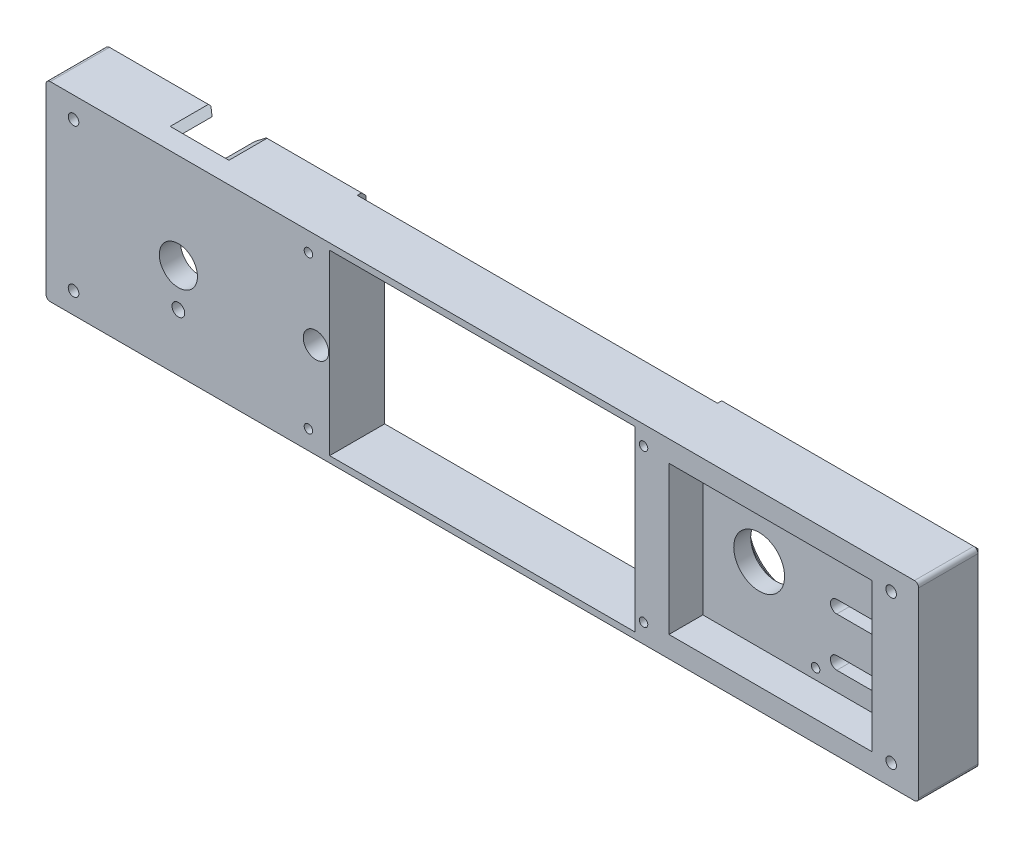
from build123d import *

# Parameters (mm, degrees)
SKETCH_1_W               = 206
SKETCH_1_H               = 45
EXTRUDE_1_DEPTH          = 15
SKETCH_1_4_W             = 85
SKETCH_1_4_H             = 45
CUT_EXTRUDE_1_DEPTH      = 2
SKETCH_1_5_W             = 72.1
SKETCH_1_5_H             = 42
CUT_EXTRUDE_2_DEPTH      = 71
SKETCH_1_6_R             = 3
CUT_EXTRUDE_3_DEPTH      = 42
SKETCH_2_R               = 22
SKETCH_2_R_2             = 4.5
CUT_EXTRUDE_4_DEPTH      = 10
SKETCH_2_3_R             = 4.5
CUT_EXTRUDE_5_DEPTH      = 50
CUT_EXTRUDE_6_DEPTH      = 17
CUT_EXTRUDE_6_DEPTH_BACK = 44
SKETCH_4_R               = 1.5
CUT_EXTRUDE_7_DEPTH      = 14
CHAMFER_1_SIZE           = 1
CHAMFER_2_SIZE           = 2
CUT_EXTRUDE_START        = -10
CUT_EXTRUDE_9_DEPTH      = 11
SKETCH_7_R               = 6
CUT_EXTRUDE_10_DEPTH     = 182
SKETCH_7_4_R             = 8.5
CUT_EXTRUDE_11_DEPTH     = 3
CHAMFER_3_SIZE           = 1
SKETCH_9_R               = 1.25
CUT_EXTRUDE_12_DEPTH     = 182
SKETCH_9_3_R             = 2.5
CUT_EXTRUDE_13_DEPTH     = 3
FILLET_1_R               = 1
SKETCH_10_W              = 47.95
SKETCH_10_H              = 35
CUT_EXTRUDE_14_DEPTH     = 8
SKETCH_11_R              = 1
CUT_EXTRUDE_15_DEPTH     = 3
CHAMFER_4_SIZE           = 1
SKETCH_12_R              = 1
CUT_EXTRUDE_16_DEPTH     = 5


with BuildPart() as part:
    # 草图1 → 凸台-拉伸1 (new body)
    with BuildSketch(Plane.XY):
        with Locations((103, 22.5)):
            Rectangle(SKETCH_1_W, SKETCH_1_H)
    extrude(amount=EXTRUDE_1_DEPTH)

    # 草图1<4> → 切除-拉伸1 (cut)
    with BuildSketch(Plane.XY):
        with Locations((103, 22.5)):
            Rectangle(SKETCH_1_4_W, SKETCH_1_4_H)
    extrude(amount=CUT_EXTRUDE_1_DEPTH, mode=Mode.SUBTRACT)

    # 草图1<5> → 切除-拉伸2 (cut)
    with BuildSketch(Plane.XY):
        with Locations((103, 22.5)):
            Rectangle(SKETCH_1_5_W, SKETCH_1_5_H)
    extrude(amount=CUT_EXTRUDE_2_DEPTH, mode=Mode.SUBTRACT)

    # 草图1<6> → 切除-拉伸3 (cut)
    with BuildSketch(Plane.XY):
        with Locations(Location((63.725, 22.5, 0), (0, 0, 180))):
            Circle(SKETCH_1_6_R)
    extrude(amount=CUT_EXTRUDE_3_DEPTH, mode=Mode.SUBTRACT)

    # 草图2 → 切除-拉伸4 (cut)
    with BuildSketch(Plane(origin=(0, 0, 0), x_dir=(-1, 0, 0), z_dir=(0, 0, -1))):
        with Locations((-31.25, 22.5)):
            Circle(SKETCH_2_R)
        with Locations((-31.25, 22.5)):
            Circle(SKETCH_2_R_2, mode=Mode.SUBTRACT)
    extrude(amount=-CUT_EXTRUDE_4_DEPTH, mode=Mode.SUBTRACT)

    # 草图2<3> → 切除-拉伸5 (cut)
    with BuildSketch(Plane(origin=(0, 0, 0), x_dir=(-1, 0, 0), z_dir=(0, 0, -1))):
        with Locations((-31.25, 22.5)):
            Circle(SKETCH_2_3_R)
    extrude(amount=-CUT_EXTRUDE_5_DEPTH, mode=Mode.SUBTRACT)

    # 草图4 → 切除-拉伸6 (cut, two sides: drawn at the far end of the back side and taken through both)
    with BuildSketch(Plane.XY.offset(15).offset(-CUT_EXTRUDE_6_DEPTH_BACK)):
        with Locations(Location((31.25, 13.5, 0), (0, 0, 180))):
            Circle(SKETCH_4_R)
    extrude(amount=CUT_EXTRUDE_6_DEPTH + CUT_EXTRUDE_6_DEPTH_BACK, mode=Mode.SUBTRACT)

    # 草图5 → 切除-拉伸7 (cut)
    with BuildSketch(Plane(origin=(0, 0, 0), x_dir=(-1, 0, 0), z_dir=(0, 0, -1))):
        with BuildLine():
            Line((-186.665399759, 35.5), (-178.665399759, 35.5))
            ThreePointArc((-178.665399759, 35.5), (-177.165399759, 34), (-178.665399759, 32.5))
            Line((-178.665399759, 32.5), (-186.665399759, 32.5))
            ThreePointArc((-186.665399759, 32.5), (-188.165399759, 34), (-186.665399759, 35.5))
        make_face()
        with BuildLine():
            Line((-186.665399759, 12.5), (-178.665399759, 12.5))
            ThreePointArc((-178.665399759, 12.5), (-177.165399759, 11), (-178.665399759, 9.5))
            Line((-178.665399759, 9.5), (-186.665399759, 9.5))
            ThreePointArc((-186.665399759, 9.5), (-188.165399759, 11), (-186.665399759, 12.5))
        make_face()
        with BuildLine():
            Line((-186.665399759, 24), (-178.665399759, 24))
            ThreePointArc((-178.665399759, 24), (-177.165399759, 22.5), (-178.665399759, 21))
            Line((-178.665399759, 21), (-186.665399759, 21))
            ThreePointArc((-186.665399759, 21), (-188.165399759, 22.5), (-186.665399759, 24))
        make_face()
    extrude(amount=-CUT_EXTRUDE_7_DEPTH, mode=Mode.SUBTRACT)

    # 倒角1
    chamfer_1_edges = [part.edges().sort_by_distance(p)[0] for p in [
        (182.665399759, 21, 0),
        (177.165399759, 22.5, 0),
        (182.665399759, 24, 0),
        (188.165399759, 34, 0),
        (182.665399759, 32.5, 0),
        (177.165399759, 34, 0),
        (182.665399759, 35.5, 0),
        (188.165399759, 11, 0),
        (182.665399759, 9.5, 0),
        (177.165399759, 11, 0),
        (182.665399759, 12.5, 0),
        (188.165399759, 22.5, 0),
    ]]
    chamfer(chamfer_1_edges, length=CHAMFER_1_SIZE)

    # 倒角2
    # the kernel refuses this chamfer: 2 mm, written as the material it takes off along each edge
    with BuildSketch(Plane(origin=(31.25, 22.5, 0), x_dir=(-1, 0, 0), z_dir=(0, -1, 0))) as chamfer_2_piece_1:
        Polygon((22 + CHAMFER_2_SIZE, 0), (22, -CHAMFER_2_SIZE), (22, 0), align=None)
    revolve(axis=Axis((31.25, 22.5, 0), (0, 0, -1)), mode=Mode.SUBTRACT)

    # 切除-拉伸9: read off the stored shape, not the designer's step
    # 切除-拉伸9 outline → 切除-拉伸9 (cut)
    with BuildSketch(Plane(origin=(0, 0, 0), x_dir=(-1, 0, 0), z_dir=(0, 0, -1)).offset(CUT_EXTRUDE_START)):
        with BuildLine():
            ThreePointArc((-25.017060641, 1.401410783), (-31.25, 0.5), (-37.482939359, 1.401410783))
            Line((-37.482939359, 1.401410783), (-39.910254038, 0))
            Line((-39.910254038, 0), (-22.898353456, 0))
            ThreePointArc((-22.898353456, 0), (-22.804826441, 0.034937268), (-22.711445573, 0.070263303))
            Line((-22.711445573, 0.070263303), (-25.017060641, 1.401410783))
        make_face()
        with BuildLine():
            Line((-38.17820323, 45), (-36.296231546, 43.913443142))
            ThreePointArc((-36.296231546, 43.913443142), (-31.25, 44.5), (-26.203768454, 43.913443142))
            Line((-26.203768454, 43.913443142), (-24.32179677, 45))
            Line((-24.32179677, 45), (-38.17820323, 45))
        make_face()
    extrude(amount=CUT_EXTRUDE_9_DEPTH, mode=Mode.SUBTRACT)

    # 草图7 → 切除-拉伸10 (cut)
    with BuildSketch(Plane(origin=(0, 0, 0), x_dir=(-1, 0, 0), z_dir=(0, 0, -1))):
        with Locations((-160.341805483, 22.5)):
            Circle(SKETCH_7_R)
    extrude(amount=-CUT_EXTRUDE_10_DEPTH, mode=Mode.SUBTRACT)

    # 草图7<4> → 切除-拉伸11 (cut)
    with BuildSketch(Plane(origin=(0, 0, 0), x_dir=(-1, 0, 0), z_dir=(0, 0, -1))):
        with Locations((-160.341805483, 22.5)):
            Circle(SKETCH_7_4_R)
    extrude(amount=-CUT_EXTRUDE_11_DEPTH, mode=Mode.SUBTRACT)

    # 倒角3
    chamfer_3_edges = [part.edges().sort_by_distance(p)[0] for p in [
        (168.841805483, 22.5, 0),
    ]]
    chamfer(chamfer_3_edges, length=CHAMFER_3_SIZE)

    # 草图9 → 切除-拉伸12 (cut)
    with BuildSketch(Plane(origin=(0, 0, 0), x_dir=(-1, 0, 0), z_dir=(0, 0, -1))):
        with Locations((-199.5, 40)):
            Circle(SKETCH_9_R)
        with Locations((-199.5, 5)):
            Circle(SKETCH_9_R)
        with Locations((-6.5, 5)):
            Circle(SKETCH_9_R)
        with Locations((-6.5, 40)):
            Circle(SKETCH_9_R)
    extrude(amount=-CUT_EXTRUDE_12_DEPTH, mode=Mode.SUBTRACT)

    # 草图9<3> → 切除-拉伸13 (cut)
    with BuildSketch(Plane(origin=(0, 0, 0), x_dir=(-1, 0, 0), z_dir=(0, 0, -1))):
        with Locations((-199.5, 40)):
            Circle(SKETCH_9_3_R)
        with Locations((-199.5, 5)):
            Circle(SKETCH_9_3_R)
        with Locations((-6.5, 5)):
            Circle(SKETCH_9_3_R)
        with Locations((-6.5, 40)):
            Circle(SKETCH_9_3_R)
    extrude(amount=-CUT_EXTRUDE_13_DEPTH, mode=Mode.SUBTRACT)

    # 圆角1
    fillet_1_edges = [part.edges().sort_by_distance(p)[0] for p in [
        (0, 0, 7.5),
        (206, 0, 7.5),
        (206, 45, 7.5),
        (0, 45, 7.5),
    ]]
    fillet(fillet_1_edges, radius=FILLET_1_R)

    # 草图10 → 切除-拉伸14 (cut)
    with BuildSketch(Plane.XY.offset(15)):
        with Locations((171.025, 22.5)):
            Rectangle(SKETCH_10_W, SKETCH_10_H)
    extrude(amount=-CUT_EXTRUDE_14_DEPTH, mode=Mode.SUBTRACT)

    # 草图11 → 切除-拉伸15 (cut)
    with BuildSketch(Plane.XY.offset(7)):
        with Locations((191.665399759, 37.5)):
            Circle(SKETCH_11_R)
        with Locations((173.665399759, 37.5)):
            Circle(SKETCH_11_R)
        with Locations((173.665399759, 7.5)):
            Circle(SKETCH_11_R)
        with Locations((191.665399759, 7.5)):
            Circle(SKETCH_11_R)
    extrude(amount=-CUT_EXTRUDE_15_DEPTH, mode=Mode.SUBTRACT)

    # 倒角4
    # the kernel refuses this chamfer: 1 mm, written as the material it takes off along each edge
    with BuildSketch(Plane(origin=(142.928317012, 0, 0), x_dir=(0, 1, 0), z_dir=(1, 0, 0)), Plane(origin=(205, 45, 0), x_dir=(0, -1, 0), z_dir=(-1, 0, 0))) as chamfer_4_piece_1:
        Polygon((CHAMFER_4_SIZE, 0), (0, CHAMFER_4_SIZE), (0, 0), align=None)
    extrude(amount=62.071682988, mode=Mode.SUBTRACT)
    with BuildSketch(Plane(origin=(205, 1, 0), x_dir=(0, -1, 0), z_dir=(-1, 0, 0))) as chamfer_4_piece_2:
        Polygon((1 - CHAMFER_4_SIZE, 0), (1, CHAMFER_4_SIZE), (1, 0), align=None)
    revolve(axis=Axis((205, 1, 0), (0, 0, 1)), revolution_arc=90, mode=Mode.SUBTRACT)
    with BuildSketch(Plane(origin=(206, 1, 0), x_dir=(-1, 0, 0), z_dir=(0, 1, 0)), Plane(origin=(0, 44, 0), x_dir=(1, 0, 0), z_dir=(0, -1, 0))) as chamfer_4_piece_3:
        Polygon((CHAMFER_4_SIZE, 0), (0, CHAMFER_4_SIZE), (0, 0), align=None)
    extrude(amount=43, mode=Mode.SUBTRACT)
    with BuildSketch(Plane(origin=(205, 44, 0), x_dir=(0, 1, 0), z_dir=(-1, 0, 0))) as chamfer_4_piece_4:
        Polygon((1 - CHAMFER_4_SIZE, 0), (1, -CHAMFER_4_SIZE), (1, 0), align=None)
    revolve(axis=Axis((205, 44, 0), (0, 0, -1)), revolution_arc=90, mode=Mode.SUBTRACT)
    with BuildSketch(Plane(origin=(37.33857105, 0, 0), x_dir=(0, 0, 1), z_dir=(1, 0, 0))) as chamfer_4_piece_5:
        Polygon((CHAMFER_4_SIZE, 0), (0, -CHAMFER_4_SIZE), (0, 0), align=None)
    extrude(amount=25.733111938, mode=Mode.SUBTRACT)
    with BuildSketch(Plane(origin=(63.071682988, 45, 0), x_dir=(0, 0, 1), z_dir=(-1, 0, 0))) as chamfer_4_piece_6:
        Polygon((CHAMFER_4_SIZE, 0), (0, -CHAMFER_4_SIZE), (0, 0), align=None)
    extrude(amount=27.841897523, mode=Mode.SUBTRACT)
    with BuildSketch(Plane(origin=(1, 0, 0), x_dir=(0, 0, 1), z_dir=(1, 0, 0))) as chamfer_4_piece_7:
        Polygon((CHAMFER_4_SIZE, 0), (0, -CHAMFER_4_SIZE), (0, 0), align=None)
    extrude(amount=24.470036444, mode=Mode.SUBTRACT)
    with BuildSketch(Plane(origin=(27.270214535, 45, 0), x_dir=(0, 0, 1), z_dir=(-1, 0, 0))) as chamfer_4_piece_8:
        Polygon((CHAMFER_4_SIZE, 0), (0, -CHAMFER_4_SIZE), (0, 0), align=None)
    extrude(amount=26.270214535, mode=Mode.SUBTRACT)
    with BuildSketch(Plane(origin=(1, 1, 0), x_dir=(0, -1, 0), z_dir=(1, 0, 0))) as chamfer_4_piece_9:
        Polygon((1 - CHAMFER_4_SIZE, 0), (1, -CHAMFER_4_SIZE), (1, 0), align=None)
    revolve(axis=Axis((1, 1, 0), (0, 0, -1)), revolution_arc=90, mode=Mode.SUBTRACT)
    with BuildSketch(Plane(origin=(1, 44, 0), x_dir=(0, 1, 0), z_dir=(1, 0, 0))) as chamfer_4_piece_10:
        Polygon((1 - CHAMFER_4_SIZE, 0), (1, CHAMFER_4_SIZE), (1, 0), align=None)
    revolve(axis=Axis((1, 44, 0), (0, 0, 1)), revolution_arc=90, mode=Mode.SUBTRACT)

    # 草图12 → 切除-拉伸16 (cut)
    with BuildSketch(Plane.XY.offset(15)):
        with Locations((61.95, 40.5)):
            Circle(SKETCH_12_R)
        with Locations((61.95, 4.5)):
            Circle(SKETCH_12_R)
        with Locations((141.05, 4.5)):
            Circle(SKETCH_12_R)
        with Locations((141.05, 40.5)):
            Circle(SKETCH_12_R)
    extrude(amount=-CUT_EXTRUDE_16_DEPTH, mode=Mode.SUBTRACT)


solid = part.part
